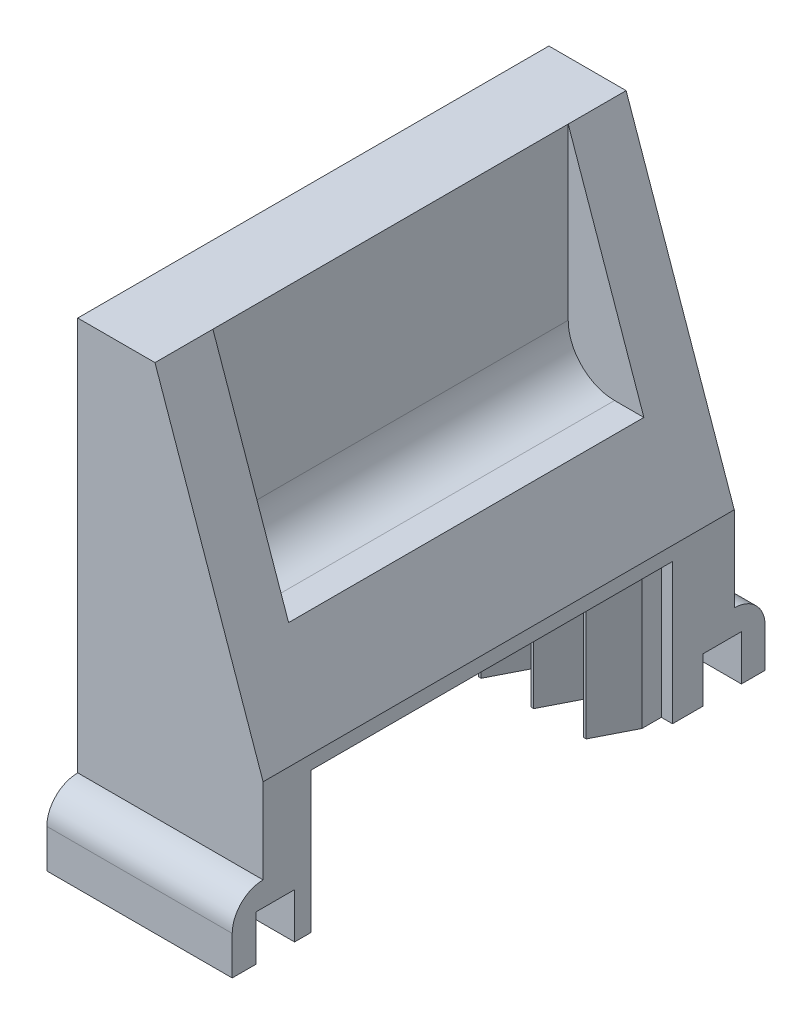
from build123d import *

# Parameters (mm, degrees)
BOSS_EXTRUDE1_DEPTH = 30.5
SKETCH4_W           = 23.4
SKETCH4_H           = 10
CUT_EXTRUDE2_DEPTH  = 25
CUT_EXTRUDE4_DEPTH  = 11.5
SKETCH7_W           = 31
SKETCH7_H           = 1.7
BOSS_EXTRUDE3_DEPTH = 9.100050305
BOSS_EXTRUDE4_DEPTH = 9.100050305
LPATTERN1_COUNT     = 9
LPATTERN1_PITCH     = 3.4
SKETCH11_W          = 12
SKETCH11_H          = 4.5
BOSS_EXTRUDE5_DEPTH = 2
FILLET1_R           = 2
FILLET2_R           = 2
FILLET5_R           = 3
SKETCH12_W          = 2.5
SKETCH12_H          = 3.5
CUT_EXTRUDE5_DEPTH  = 12


with BuildPart() as part:
    # Sketch1 → Boss-Extrude1 (new body)
    with BuildSketch(Plane.XY):
        Polygon((0, 0), (0, -30), (12, -30), (12, -20), (5, 0), align=None)
    extrude(amount=-BOSS_EXTRUDE1_DEPTH)

    # Sketch4 → Cut-Extrude2 (cut)
    with BuildSketch(Plane.ZY):
        with Locations((-14.8, -25.899949695)):
            Rectangle(SKETCH4_W, SKETCH4_H)
    extrude(amount=-CUT_EXTRUDE2_DEPTH, mode=Mode.SUBTRACT)

    # Sketch6 → Cut-Extrude4 (cut, symmetric)
    with BuildSketch(Plane.XY.offset(-15.25)):
        Polygon((5, 0), (5, -14), (9.9, -14), align=None)
    extrude(amount=CUT_EXTRUDE4_DEPTH, both=True, mode=Mode.SUBTRACT)

    # Sketch7 → Boss-Extrude3 (add)
    with BuildSketch(Plane(origin=(0, -30, 0), x_dir=(1, 0, 0), z_dir=(0, 1, 0))):
        with Locations((-4.2231607, 26.1)):
            Rectangle(SKETCH7_W, SKETCH7_H)
    extrude(amount=BOSS_EXTRUDE3_DEPTH)

    # Sketch10 → Boss-Extrude4 (add)
    with BuildSketch(Plane(origin=(0, -20.899949695, 0), x_dir=(1, 0, 0), z_dir=(0, 1, 0))):
        Polygon((11.2768393, 25.25), (10.057972835, 22.860002615), (9.869194152, 22.860002615), (8.630940097, 25.25), align=None)
    boss_extrude4 = extrude(amount=-BOSS_EXTRUDE4_DEPTH)

    # LPattern1: Boss-Extrude4 ×9
    with Locations(*[(-i * LPATTERN1_PITCH, 0, 0) for i in range(1, LPATTERN1_COUNT)]):
        add(boss_extrude4)

    # Sketch11 → Boss-Extrude5 (add)
    with BuildSketch(Plane(origin=(0, 0, -30.5), x_dir=(-1, 0, 0), z_dir=(0, 0, -1))):
        with Locations((-6, -27.75)):
            Rectangle(SKETCH11_W, SKETCH11_H)
    boss_extrude5 = extrude(amount=BOSS_EXTRUDE5_DEPTH)

    # Fillet1
    fillet1_edges = [part.edges().sort_by_distance(p)[0] for p in [
        (6, -25.5, -32.5),
    ]]
    fillet(fillet1_edges, radius=FILLET1_R - 0.0001)  # a hair under: the kernel refuses the full size

    # Mirror1: Boss-Extrude5 across plane
    add(boss_extrude5.mirror(Plane.XY.offset(-15.25)))

    # Fillet2
    fillet2_edges = [part.edges().sort_by_distance(p)[0] for p in [
        (6, -25.5, 2),
    ]]
    fillet(fillet2_edges, radius=FILLET2_R - 0.0001)  # a hair under: the kernel refuses the full size

    # Fillet5
    fillet5_edges = [part.edges().sort_by_distance(p)[0] for p in [
        (5, -14, -15.25),
    ]]
    fillet(fillet5_edges, radius=FILLET5_R)

    # Sketch12 → Cut-Extrude5 (cut)
    with BuildSketch(Plane.ZY):
        with Locations((-29.713851252, -28.814354386)):
            Rectangle(SKETCH12_W, SKETCH12_H)
        with Locations((-0.786148748, -28.814354386)):
            Rectangle(SKETCH12_W, SKETCH12_H)
    extrude(amount=-CUT_EXTRUDE5_DEPTH, mode=Mode.SUBTRACT)


solid = part.part
